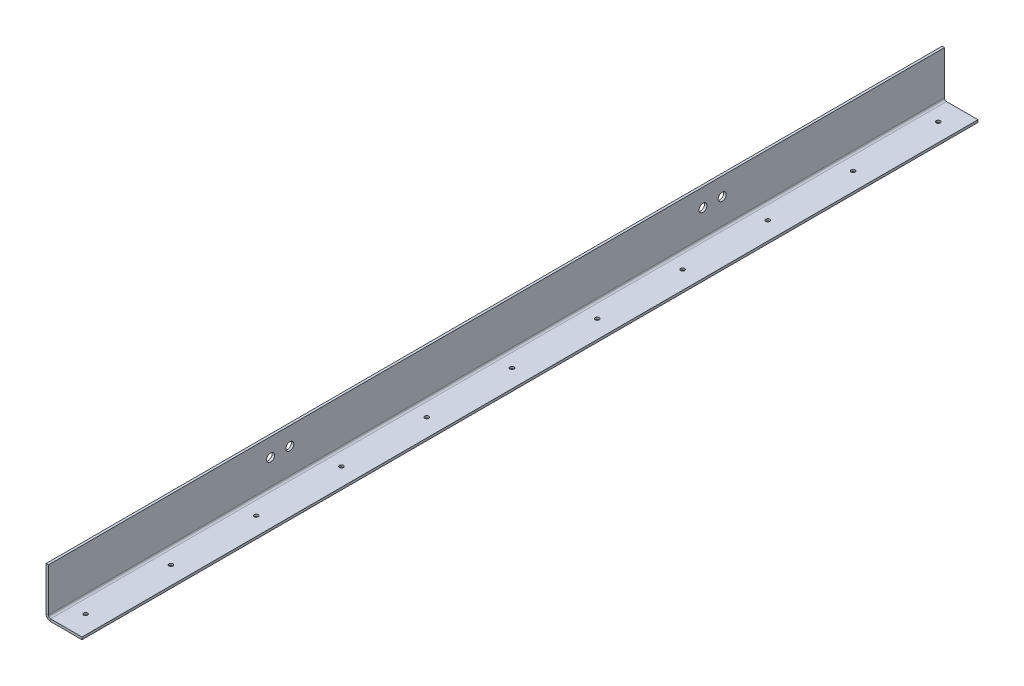
from build123d import *

# Parameters (mm, degrees)
SM_BASE_FLANGE_1_DEPTH      = 746
HOLE_WIZARD_M41_D           = 3.3
HOLE_WIZARD_M41_DEPTH       = 11.5
HOLE_WIZARD_M41_CSINK_D     = 4.05
HOLE_WIZARD_M41_CSINK_ANGLE = 90
HOLE_WIZARD_M41_TIP         = 0.991420021
HOLE_WIZARD_M61_D           = 6.6
HOLE_WIZARD_M61_DEPTH       = 59
HOLE_WIZARD_M61_TIP         = 1.982840043


# Sheet-metal steps are written as plain solids
with BuildPart() as part:
    # Sketch 1 → Базовая кромка1 (new body)
    with BuildSketch(Plane.XY):
        with BuildLine():
            Line((0, 40), (0, 3.8))
            ThreePointArc((0, 3.8), (1.112994231, 1.112994231), (3.8, 0))
            Line((3.8, 0), (30, 0))
            Line((30, 0), (30, 2))
            Line((30, 2), (3.8, 2))
            ThreePointArc((3.8, 2), (2.527207794, 2.527207794), (2, 3.8))
            Line((2, 3.8), (2, 40))
            Line((2, 40), (0, 40))
        make_face()
    extrude(amount=SM_BASE_FLANGE_1_DEPTH)

    # Отверстие обработанное метчиком M41
    with Locations(Plane(origin=(0, 0, 0), x_dir=(-1, 0, 0), z_dir=(0, -1, 0))):
        with Locations((-15, -18), (-15, -89), (-15, -160), (-15, -231), (-15, -302), (-15, -373), (-15, -444), (-15, -515), (-15, -586), (-15, -657), (-15, -728)):
            CounterSinkHole(HOLE_WIZARD_M41_D / 2, HOLE_WIZARD_M41_CSINK_D / 2, depth=HOLE_WIZARD_M41_DEPTH, counter_sink_angle=HOLE_WIZARD_M41_CSINK_ANGLE)
            with Locations((0, 0, -(HOLE_WIZARD_M41_DEPTH + HOLE_WIZARD_M41_TIP / 2))):  # 118° drill point
                Cone(0, HOLE_WIZARD_M41_D / 2, HOLE_WIZARD_M41_TIP, mode=Mode.SUBTRACT)

    # Отверстие с зазором M61
    with Locations(Plane.ZY):
        with Locations((561, 25), (545, 25), (185, 25), (201, 25)):
            Hole(HOLE_WIZARD_M61_D / 2, depth=HOLE_WIZARD_M61_DEPTH)
            with Locations((0, 0, -(HOLE_WIZARD_M61_DEPTH + HOLE_WIZARD_M61_TIP / 2))):  # 118° drill point
                Cone(0, HOLE_WIZARD_M61_D / 2, HOLE_WIZARD_M61_TIP, mode=Mode.SUBTRACT)


solid = part.part
